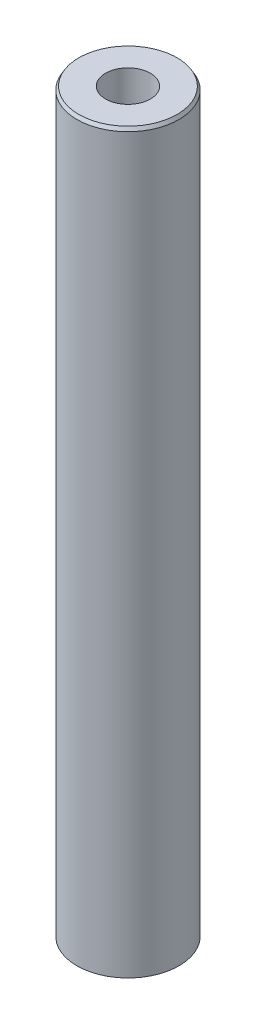
from build123d import *
from OCP.BRepFilletAPI import BRepFilletAPI_MakeChamfer

# Parameters (mm, degrees)
SKETCH1_R           = 35
BOSS_EXTRUDE1_DEPTH = 505.789465377
SKETCH2_R           = 15.349277597
CUT_EXTRUDE1_DEPTH  = 509.205650585
CHAMFER1_SIZE       = 2.330473725
CHAMFER1_SIZE2      = 1.345499632


with BuildPart() as part:
    # Sketch1 → Boss-Extrude1 (new body)
    with BuildSketch(Plane(origin=(0, 0, 0), x_dir=(1, 0, 0), z_dir=(0, 1, 0))):
        Circle(SKETCH1_R)
    extrude(amount=BOSS_EXTRUDE1_DEPTH)

    # Sketch2 → Cut-Extrude1 (cut, through all)
    with BuildSketch(Plane(origin=(0, 0, 0), x_dir=(1, 0, 0), z_dir=(0, 1, 0))):
        Circle(SKETCH2_R)
    extrude(amount=CUT_EXTRUDE1_DEPTH, mode=Mode.SUBTRACT)

    # Chamfer1: one chamfer whose edges measure the first distance from different faces: ONE call of the kernel's chamfer builder (chamfer() names one face for all edges)
    chamfer1_edges_1 = [part.edges().sort_by_distance(p)[0] for p in [
        (-35, 505.789465377, 0),
    ]]
    chamfer1_side_1 = [part.faces().sort_by_distance(p)[0] for p in [
        (-35, 252.894732689, 0),
    ]]
    chamfer1_edges_2 = [part.edges().sort_by_distance(p)[0] for p in [
        (-35, 0, 0),
    ]]
    chamfer1_side_2 = [part.faces().sort_by_distance(p)[0] for p in [
        (-34.010050506, 0, 0),
    ]]
    chamfer1 = BRepFilletAPI_MakeChamfer(part.part.solid().wrapped)
    for e in chamfer1_edges_1:
        chamfer1.Add(CHAMFER1_SIZE, CHAMFER1_SIZE2, e.wrapped, chamfer1_side_1[0].wrapped)  # the first distance lies on this face
    for e in chamfer1_edges_2:
        chamfer1.Add(CHAMFER1_SIZE, CHAMFER1_SIZE2, e.wrapped, chamfer1_side_2[0].wrapped)  # the first distance lies on this face
    add(Compound.cast(chamfer1.Shape()), mode=Mode.REPLACE)


solid = part.part
